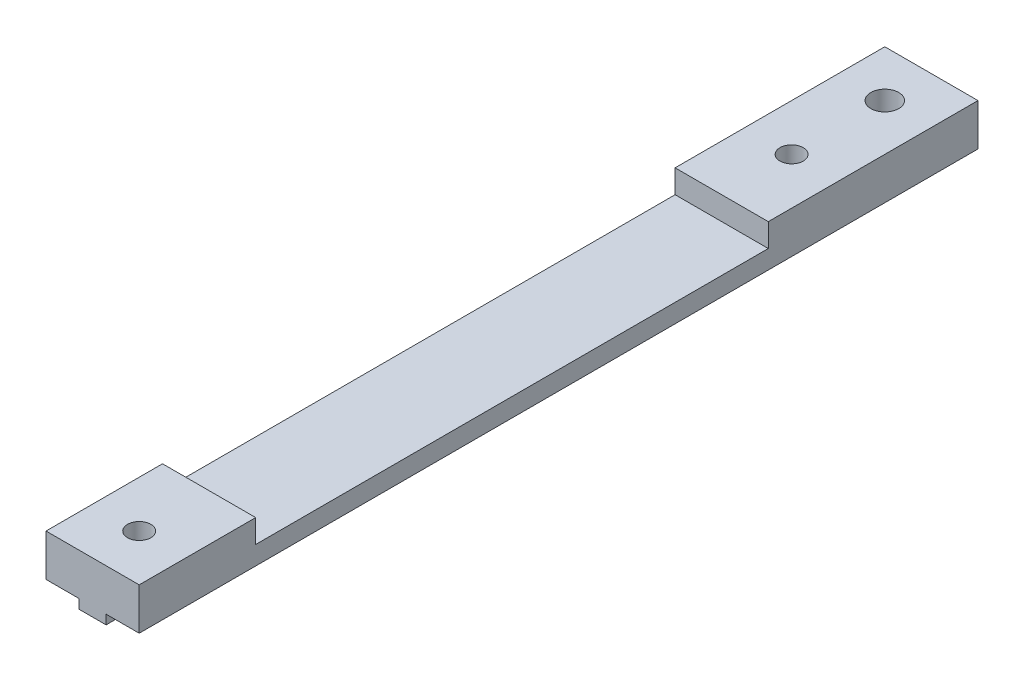
from build123d import *

# Parameters (mm, degrees)
MAIN_DEPTH      = 90
SKETCH2_R       = 1.25
SKETCH2_R_2     = 1.5
MAINHOLES_DEPTH = 91.306422806
SKETCH3_W       = 10
SKETCH3_H       = 55
PINHOLES_DEPTH  = 2.5


with BuildPart() as part:
    # Sketch1 → Main (new body)
    with BuildSketch(Plane.XY):
        Polygon((-5, 0), (5, 0), (5, -4.5), (1.45, -4.5), (1.45, -5.5), (-1.45, -5.5), (-1.45, -4.5), (-5, -4.5), align=None)
    extrude(amount=MAIN_DEPTH)

    # Sketch2 → MainHoles (cut, through all)
    with BuildSketch(Plane(origin=(0, 0, 0), x_dir=(1, 0, 0), z_dir=(0, 1, 0))):
        with Locations((0, -85)):
            Circle(SKETCH2_R)
        with Locations((0, -15)):
            Circle(SKETCH2_R)
        with Locations((0, -5)):
            Circle(SKETCH2_R_2)
    extrude(amount=-MAINHOLES_DEPTH, mode=Mode.SUBTRACT)

    # Sketch3 → PinHoles (cut)
    with BuildSketch(Plane(origin=(0, 0, 0), x_dir=(1, 0, 0), z_dir=(0, 1, 0))):
        with Locations((0, -50)):
            Rectangle(SKETCH3_W, SKETCH3_H)
    extrude(amount=-PINHOLES_DEPTH, mode=Mode.SUBTRACT)


solid = part.part
